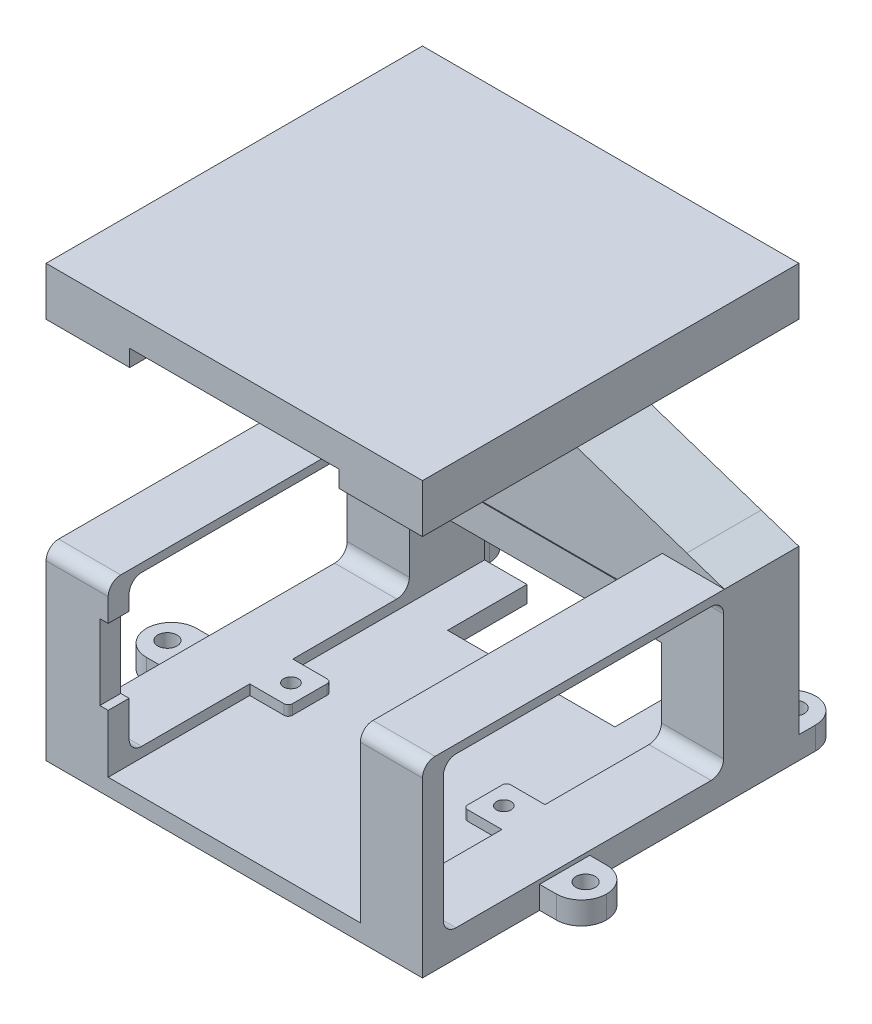
from build123d import *
from OCP.BRepFilletAPI import BRepFilletAPI_MakeChamfer

# Parameters (mm, degrees)
ESQUISSE2_W             = 90
ESQUISSE2_H             = 90
BOSS_EXTRU_1_DEPTH      = 4
ESQUISSE3_W             = 9.2
ESQUISSE3_H             = 10.3
BOSS_EXTRU_2_DEPTH      = 2.4
CONG_1_R                = 1
ESQUISSE5_W             = 14.85
ESQUISSE5_H             = 90
BOSS_EXTRU_3_DEPTH      = 2.4
ESQUISSE6_W             = 14.85
ESQUISSE6_H             = 5
BOSS_EXTRU_4_DEPTH      = 38
ESQUISSE8_W             = 14.85
ESQUISSE8_H             = 18
BOSS_EXTRU_5_DEPTH      = 38
BOSS_EXTRU_6_REACH      = 97.814
ESQUISSE9_W             = 14.85
ESQUISSE9_H             = 2
CONG_1_OF_SYM_TRIE1_R   = 1
ENL_V_MAT_EXTRU_1_REACH = 111.983
ESQUISSE10_W            = 2
ESQUISSE10_H            = 18
ENL_V_MAT_EXTRU_2_REACH = 77.38
ESQUISSE11_W            = 40
ESQUISSE11_H            = 18
BOSS_EXTRU_7_REACH      = 100.203
ESQUISSE12_W            = 5.5
ESQUISSE12_H            = 7.6
ESQUISSE13_W            = 6.9
ESQUISSE13_H            = 7.6
BOSS_EXTRU_8_DEPTH      = 2.45
CONG_2_R                = 1
CONG_2_OF_SYM_TRIE2_R   = 1
BOSS_EXTRU_9_DEPTH      = 3
BOSS_EXTRU_9_DEPTH_BACK = 3
ESQUISSE14_W            = 90
ESQUISSE14_H            = 17.8
ESQUISSE15_W            = 15
ESQUISSE15_H            = 17.8
BOSS_EXTRU_10_DEPTH     = 44
ESQUISSE16_W            = 90
ESQUISSE16_H            = 90
BOSS_EXTRU_11_DEPTH     = 11.6
ESQUISSE20_W            = 12
ESQUISSE20_H            = 5.4
BOSS_EXTRU_13_DEPTH     = 10
ESQUISSE21_W            = 12
ESQUISSE21_H            = 5.4
BOSS_EXTRU_14_DEPTH     = 10
CONG_3_R                = 6
ENL_V_MAT_EXTRU_4_REACH = 126.022
ESQUISSE23_R            = 2.3
CONG_3_OF_SYM_TRIE3_R   = 6
ENL_V_MAT_EXTRU_5_REACH = 126.022
ESQUISSE24_R            = 1.75
ENL_V_MAT_EXTRU_6_REACH = 137.909
ESQUISSE26_R            = 1.75
ESQUISSE27_W            = 50
ESQUISSE27_H            = 4
ENL_V_MAT_EXTRU_7_DEPTH = 72.2
CHANFREIN3_SIZE         = 28.5
CHANFREIN3_SIZE2        = 9.5
CHANFREIN4_SIZE         = 10
CHANFREIN4_SIZE2        = 17.5
CHANFREIN8_START        = -45
CHANFREIN8_DEPTH        = 17.8
CHANFREIN9_SIZE         = 3
CHANFREIN9_SIZE_2       = 9
CHANFREIN10_START       = 25.930676813
CHANFREIN10_OUTLINE_W   = 40
CHANFREIN10_OUTLINE_H   = 3.16227766
CHANFREIN10_DEPTH       = 2.069323187
CONG_9_R                = 3
CHANFREIN13_START       = -45
CHANFREIN13_DEPTH       = 17.8
CONG_10_R               = 3
ESQUISSE37_R            = 4
ENL_V_MAT_EXTRU_8_DEPTH = 3
BOSS_EXTRU_15_DEPTH     = 5.3
CONG_11_R               = 3


with BuildPart() as part:
    # Esquisse2 → Boss.-Extru.1 (new body)
    with BuildSketch(Plane(origin=(0, 0, 0), x_dir=(1, 0, 0), z_dir=(0, 1, 0))):
        Rectangle(ESQUISSE2_W, ESQUISSE2_H)
    extrude(amount=BOSS_EXTRU_1_DEPTH)

    # Esquisse3 → Boss.-Extru.2 (add)
    with BuildSketch(Plane(origin=(0, 4, 0), x_dir=(1, 0, 0), z_dir=(0, 1, 0))):
        with Locations((25.55, -6)):
            Rectangle(ESQUISSE3_W, ESQUISSE3_H)
    boss_extru_2 = extrude(amount=BOSS_EXTRU_2_DEPTH)

    # Congé1
    cong_1_edges = [part.edges().sort_by_distance(p)[0] for p in [
        (20.95, 5.2, 0.85),
        (20.95, 5.2, 11.15),
    ]]
    fillet(cong_1_edges, radius=CONG_1_R)

    # Esquisse5 → Boss.-Extru.3 (add)
    with BuildSketch(Plane(origin=(0, 4, 0), x_dir=(1, 0, 0), z_dir=(0, 1, 0))):
        with Locations((37.575, 0)):
            Rectangle(ESQUISSE5_W, ESQUISSE5_H)
    boss_extru_3 = extrude(amount=BOSS_EXTRU_3_DEPTH)

    # Esquisse6 → Boss.-Extru.4 (add)
    with BuildSketch(Plane(origin=(0, 6.4, 0), x_dir=(1, 0, 0), z_dir=(0, 1, 0))):
        with Locations((37.575, -42.5)):
            Rectangle(ESQUISSE6_W, ESQUISSE6_H)
    boss_extru_4 = extrude(amount=BOSS_EXTRU_4_DEPTH)

    # Esquisse8 → Boss.-Extru.5 (add)
    with BuildSketch(Plane(origin=(0, 6.4, 0), x_dir=(1, 0, 0), z_dir=(0, 1, 0))):
        with Locations((37.575, 36)):
            Rectangle(ESQUISSE8_W, ESQUISSE8_H)
    boss_extru_5 = extrude(amount=BOSS_EXTRU_5_DEPTH)

    # Esquisse9 → Boss.-Extru.6 (add, up to next)
    with BuildSketch(Plane.XY.offset(-27), mode=Mode.PRIVATE) as boss_extru_6_sk1:
        with Locations((37.575, 43.4)):
            Rectangle(ESQUISSE9_W, ESQUISSE9_H)
    boss_extru_6_tool1 = extrude(boss_extru_6_sk1.sketch, amount=BOSS_EXTRU_6_REACH, mode=Mode.PRIVATE) - part.part
    boss_extru_6 = boss_extru_6_tool1.solids().sort_by_distance((37.575, 43.4, -27))[0]
    add(boss_extru_6)

    # Symétrie1: Boss.-Extru.2, Boss.-Extru.3, Boss.-Extru.4, Boss.-Extru.5, Boss.-Extru.6 across plane
    add(boss_extru_2.mirror(Plane(origin=(0, 0, 0), x_dir=(0, 0, 1), z_dir=(1, 0, 0))))
    add(boss_extru_3.mirror(Plane(origin=(0, 0, 0), x_dir=(0, 0, 1), z_dir=(1, 0, 0))))
    add(boss_extru_4.mirror(Plane(origin=(0, 0, 0), x_dir=(0, 0, 1), z_dir=(1, 0, 0))))
    add(boss_extru_5.mirror(Plane(origin=(0, 0, 0), x_dir=(0, 0, 1), z_dir=(1, 0, 0))))
    add(boss_extru_6.mirror(Plane(origin=(0, 0, 0), x_dir=(0, 0, 1), z_dir=(1, 0, 0))))

    # Congé1 of Symétrie1
    cong_1_of_sym_trie1_edges = [part.edges().sort_by_distance(p)[0] for p in [
        (-20.95, 5.2, 0.85),
        (-20.95, 5.2, 11.15),
    ]]
    fillet(cong_1_of_sym_trie1_edges, radius=CONG_1_OF_SYM_TRIE1_R)

    # Esquisse10 → Enlèv. mat.-Extru.1 (cut, up to next)
    with BuildSketch(Plane.XY.offset(45), mode=Mode.PRIVATE) as enl_v_mat_extru_1_sk1:
        with Locations((-31.15, 26.85)):
            Rectangle(ESQUISSE10_W, ESQUISSE10_H)
    enl_v_mat_extru_1_tool1 = extrude(enl_v_mat_extru_1_sk1.sketch, amount=-ENL_V_MAT_EXTRU_1_REACH, mode=Mode.PRIVATE) & part.part
    add(enl_v_mat_extru_1_tool1.solids().sort_by_distance((-31.15, 26.85, 45))[0], mode=Mode.SUBTRACT)

    # Esquisse11 → Enlèv. mat.-Extru.2 (cut, up to next)
    with BuildSketch(Plane(origin=(0, 4, 0), x_dir=(1, 0, 0), z_dir=(0, 1, 0)), mode=Mode.PRIVATE) as enl_v_mat_extru_2_sk1:
        with Locations((0, 36)):
            Rectangle(ESQUISSE11_W, ESQUISSE11_H)
    enl_v_mat_extru_2_tool1 = extrude(enl_v_mat_extru_2_sk1.sketch, amount=-ENL_V_MAT_EXTRU_2_REACH, mode=Mode.PRIVATE) & part.part
    add(enl_v_mat_extru_2_tool1.solids().sort_by_distance((0, 4, -36))[0], mode=Mode.SUBTRACT)

    # Esquisse12 → Boss.-Extru.7 (add, up to next)
    with BuildSketch(Plane(origin=(-30.15, 0, 0), x_dir=(0, 0, -1), z_dir=(1, 0, 0)), mode=Mode.PRIVATE) as boss_extru_7_sk1:
        with Locations((29.75, 29.84)):
            Rectangle(ESQUISSE12_W, ESQUISSE12_H)
    boss_extru_7_tool1 = extrude(boss_extru_7_sk1.sketch, amount=BOSS_EXTRU_7_REACH, mode=Mode.PRIVATE) - part.part
    add(boss_extru_7_tool1.solids().sort_by_distance((-30.15, 29.84, -29.75))[0])

    # Esquisse13 → Boss.-Extru.8 (add)
    with BuildSketch(Plane.XY.offset(-27)):
        with Locations((24.4, 29.84)):
            Rectangle(ESQUISSE13_W, ESQUISSE13_H)
    boss_extru_8 = extrude(amount=BOSS_EXTRU_8_DEPTH)

    # Congé2
    cong_2_edges = [part.edges().sort_by_distance(p)[0] for p in [
        (20.95, 33.64, -25.775),
        (20.95, 26.04, -25.775),
    ]]
    fillet(cong_2_edges, radius=CONG_2_R)

    # Symétrie2: Boss.-Extru.8 across plane
    add(boss_extru_8.mirror(Plane(origin=(0, 0, 0), x_dir=(0, 0, 1), z_dir=(1, 0, 0))))

    # Congé2 of Symétrie2
    cong_2_of_sym_trie2_edges = [part.edges().sort_by_distance(p)[0] for p in [
        (-20.95, 33.64, -25.775),
        (-20.95, 26.04, -25.775),
    ]]
    fillet(cong_2_of_sym_trie2_edges, radius=CONG_2_OF_SYM_TRIE2_R)

    # Esquisse14 → Boss.-Extru.9 (add, two sides: drawn at the far end of the back side and taken through both)
    with BuildSketch(Plane(origin=(0, 44.4, 0), x_dir=(1, 0, 0), z_dir=(0, 1, 0)).offset(-BOSS_EXTRU_9_DEPTH_BACK)):
        with Locations((0, 36.1)):
            Rectangle(ESQUISSE14_W, ESQUISSE14_H)
    extrude(amount=BOSS_EXTRU_9_DEPTH + BOSS_EXTRU_9_DEPTH_BACK)

    # Esquisse15 → Boss.-Extru.10 (add)
    with BuildSketch(Plane(origin=(0, 47.4, 0), x_dir=(1, 0, 0), z_dir=(0, 1, 0))):
        with Locations((0, 36.1)):
            Rectangle(ESQUISSE15_W, ESQUISSE15_H)
    extrude(amount=BOSS_EXTRU_10_DEPTH)

    # Esquisse16 → Boss.-Extru.11 (add)
    with BuildSketch(Plane(origin=(0, 91.4, 0), x_dir=(1, 0, 0), z_dir=(0, 1, 0))):
        Rectangle(ESQUISSE16_W, ESQUISSE16_H)
    extrude(amount=BOSS_EXTRU_11_DEPTH)

    # Esquisse20 → Boss.-Extru.13 (add)
    with BuildSketch(Plane(origin=(45, 0, 0), x_dir=(0, 0, -1), z_dir=(1, 0, 0))):
        with Locations((-11, 2.7)):
            Rectangle(ESQUISSE20_W, ESQUISSE20_H)
    boss_extru_13 = extrude(amount=BOSS_EXTRU_13_DEPTH)

    # Esquisse21 → Boss.-Extru.14 (add)
    with BuildSketch(Plane(origin=(0, 0, -45), x_dir=(-1, 0, 0), z_dir=(0, 0, -1))):
        with Locations((-39, 2.7)):
            Rectangle(ESQUISSE21_W, ESQUISSE21_H)
    boss_extru_14 = extrude(amount=BOSS_EXTRU_14_DEPTH)

    # Congé3
    cong_3_edges = [part.edges().sort_by_distance(p)[0] for p in [
        (33, 2.7, -55),
        (45, 2.7, -55),
        (55, 2.7, 5),
        (55, 2.7, 17),
    ]]
    fillet(cong_3_edges, radius=CONG_3_R - 0.0001)  # a hair under: the kernel refuses the full size

    # Esquisse23 → Enlèv. mat.-Extru.4 (cut, up to next)
    with BuildSketch(Plane(origin=(0, 6.4, 0), x_dir=(1, 0, 0), z_dir=(0, 1, 0)), mode=Mode.PRIVATE) as enl_v_mat_extru_4_sk1:
        with Locations(Location((50, -11, 0), (0, 0, 90))):
            Circle(ESQUISSE23_R)
    enl_v_mat_extru_4_tool1 = extrude(enl_v_mat_extru_4_sk1.sketch, amount=-ENL_V_MAT_EXTRU_4_REACH, mode=Mode.PRIVATE) & part.part
    # Esquisse23 → Enlèv. mat.-Extru.4 (cut, up to next)
    with BuildSketch(Plane(origin=(0, 6.4, 0), x_dir=(1, 0, 0), z_dir=(0, 1, 0)), mode=Mode.PRIVATE) as enl_v_mat_extru_4_sk2:
        with Locations(Location((39, 50, 0), (0, 0, 90))):
            Circle(ESQUISSE23_R)
    enl_v_mat_extru_4_tool2 = extrude(enl_v_mat_extru_4_sk2.sketch, amount=-ENL_V_MAT_EXTRU_4_REACH, mode=Mode.PRIVATE) & part.part
    enl_v_mat_extru_4_1 = enl_v_mat_extru_4_tool1.solids().sort_by_distance((50, 6.4, 11))[0]
    add(enl_v_mat_extru_4_1, mode=Mode.SUBTRACT)
    enl_v_mat_extru_4_2 = enl_v_mat_extru_4_tool2.solids().sort_by_distance((39, 6.4, -50))[0]
    add(enl_v_mat_extru_4_2, mode=Mode.SUBTRACT)
    enl_v_mat_extru_4 = enl_v_mat_extru_4_1 + enl_v_mat_extru_4_2  # Enlèv. mat.-Extru.4 as one shape, for the pattern or mirror that repeats it

    # Symétrie3: Boss.-Extru.13, Boss.-Extru.14, Enlèv. mat.-Extru.4 across plane
    add(boss_extru_13.mirror(Plane(origin=(0, 0, 0), x_dir=(0, 0, 1), z_dir=(1, 0, 0))))
    add(boss_extru_14.mirror(Plane(origin=(0, 0, 0), x_dir=(0, 0, 1), z_dir=(1, 0, 0))))
    add(enl_v_mat_extru_4.mirror(Plane(origin=(0, 0, 0), x_dir=(0, 0, 1), z_dir=(1, 0, 0))), mode=Mode.SUBTRACT)

    # Congé3 of Symétrie3
    cong_3_of_sym_trie3_edges = [part.edges().sort_by_distance(p)[0] for p in [
        (-33, 2.7, -55),
        (-45, 2.7, -55),
        (-55, 2.7, 5),
        (-55, 2.7, 17),
    ]]
    fillet(cong_3_of_sym_trie3_edges, radius=CONG_3_OF_SYM_TRIE3_R - 0.0001)  # a hair under: the kernel refuses the full size

    # Esquisse24 → Enlèv. mat.-Extru.5 (cut, up to next)
    with BuildSketch(Plane(origin=(0, 6.4, 0), x_dir=(1, 0, 0), z_dir=(0, 1, 0)), mode=Mode.PRIVATE) as enl_v_mat_extru_5_sk1:
        with Locations(Location((25.45, -6, 0), (0, 0, 270))):
            Circle(ESQUISSE24_R)
    enl_v_mat_extru_5_tool1 = extrude(enl_v_mat_extru_5_sk1.sketch, amount=-ENL_V_MAT_EXTRU_5_REACH, mode=Mode.PRIVATE) & part.part
    enl_v_mat_extru_5 = enl_v_mat_extru_5_tool1.solids().sort_by_distance((25.45, 6.4, 6))[0]
    add(enl_v_mat_extru_5, mode=Mode.SUBTRACT)

    # Esquisse26 → Enlèv. mat.-Extru.6 (cut, up to next)
    with BuildSketch(Plane.XY.offset(-24.55), mode=Mode.PRIVATE) as enl_v_mat_extru_6_sk1:
        with Locations((25.55, 28.44)):
            Circle(ESQUISSE26_R)
    enl_v_mat_extru_6_tool1 = extrude(enl_v_mat_extru_6_sk1.sketch, amount=-ENL_V_MAT_EXTRU_6_REACH, mode=Mode.PRIVATE) & part.part
    enl_v_mat_extru_6 = enl_v_mat_extru_6_tool1.solids().sort_by_distance((25.55, 28.44, -24.55))[0]
    add(enl_v_mat_extru_6, mode=Mode.SUBTRACT)

    # Symétrie5: Enlèv. mat.-Extru.5, Enlèv. mat.-Extru.6 across plane
    add(enl_v_mat_extru_5.mirror(Plane(origin=(0, 0, 0), x_dir=(0, 0, 1), z_dir=(1, 0, 0))), mode=Mode.SUBTRACT)
    add(enl_v_mat_extru_6.mirror(Plane(origin=(0, 0, 0), x_dir=(0, 0, 1), z_dir=(1, 0, 0))), mode=Mode.SUBTRACT)

    # Esquisse27 → Enlèv. mat.-Extru.7 (cut)
    with BuildSketch(Plane.XY.offset(45)):
        with Locations((0, 93.4)):
            Rectangle(ESQUISSE27_W, ESQUISSE27_H)
    extrude(amount=-ENL_V_MAT_EXTRU_7_DEPTH, mode=Mode.SUBTRACT)

    # Chanfrein3: one chamfer whose edges measure the first distance from different faces: ONE call of the kernel's chamfer builder (chamfer() names one face for all edges)
    chanfrein3_edges_1 = [part.edges().sort_by_distance(p)[0] for p in [
        (-7.5, 47.4, -36.1),
    ]]
    chanfrein3_side_1 = [part.faces().sort_by_distance(p)[0] for p in [
        (-26.25, 47.4, -36.1),
    ]]
    chanfrein3_edges_2 = [part.edges().sort_by_distance(p)[0] for p in [
        (7.5, 47.4, -36.1),
    ]]
    chanfrein3_side_2 = [part.faces().sort_by_distance(p)[0] for p in [
        (26.25, 47.4, -36.1),
    ]]
    chanfrein3 = BRepFilletAPI_MakeChamfer(part.part.solid().wrapped)
    for e in chanfrein3_edges_1:
        chanfrein3.Add(CHANFREIN3_SIZE, CHANFREIN3_SIZE2, e.wrapped, chanfrein3_side_1[0].wrapped)  # the first distance lies on this face
    for e in chanfrein3_edges_2:
        chanfrein3.Add(CHANFREIN3_SIZE, CHANFREIN3_SIZE2, e.wrapped, chanfrein3_side_2[0].wrapped)  # the first distance lies on this face
    add(Compound.cast(chanfrein3.Shape()), mode=Mode.REPLACE)

    # Chanfrein4: one chamfer whose edges measure the first distance from different faces: ONE call of the kernel's chamfer builder (chamfer() names one face for all edges)
    chanfrein4_edges_1 = [part.edges().sort_by_distance(p)[0] for p in [
        (7.5, 91.4, -36.1),
    ]]
    chanfrein4_side_1 = [part.faces().sort_by_distance(p)[0] for p in [
        (7.5, 74.15, -36.1),
    ]]
    chanfrein4_edges_2 = [part.edges().sort_by_distance(p)[0] for p in [
        (-7.5, 91.4, -36.1),
    ]]
    chanfrein4_side_2 = [part.faces().sort_by_distance(p)[0] for p in [
        (-7.5, 74.15, -36.1),
    ]]
    chanfrein4 = BRepFilletAPI_MakeChamfer(part.part.solid().wrapped)
    for e in chanfrein4_edges_1:
        chanfrein4.Add(CHANFREIN4_SIZE, CHANFREIN4_SIZE2, e.wrapped, chanfrein4_side_1[0].wrapped)  # the first distance lies on this face
    for e in chanfrein4_edges_2:
        chanfrein4.Add(CHANFREIN4_SIZE, CHANFREIN4_SIZE2, e.wrapped, chanfrein4_side_2[0].wrapped)  # the first distance lies on this face
    add(Compound.cast(chanfrein4.Shape()), mode=Mode.REPLACE)

    # Chanfrein8: read off the stored shape, not the designer's step
    # Chanfrein8 outline → Chanfrein8 (add)
    with BuildSketch(Plane.XY.offset(CHANFREIN8_START)):
        Polygon((30.15, 31.35), (30.15, 41.4), (0, 41.4), align=None)
    extrude(amount=CHANFREIN8_DEPTH)

    # Chanfrein9
    chanfrein9_edges_1 = [part.edges().sort_by_distance(p)[0] for p in [
        (45, 47.4, -36.1),
    ]]
    chanfrein9_side_1 = [part.faces().sort_by_distance(p)[0] for p in [
        (45, 47.34, -36.1),
    ]]
    chanfrein9_edges_2 = [part.edges().sort_by_distance(p)[0] for p in [
        (-45, 47.4, -36.1),
    ]]
    chanfrein9_side_2 = [part.faces().sort_by_distance(p)[0] for p in [
        (-44.94, 47.4, -36.1),
    ]]
    chanfrein9 = BRepFilletAPI_MakeChamfer(part.part.solid().wrapped)
    for e in chanfrein9_edges_1:
        chanfrein9.Add(CHANFREIN9_SIZE - 0.0001, CHANFREIN9_SIZE_2 - 0.0001, e.wrapped, chanfrein9_side_1[0].wrapped)
    for e in chanfrein9_edges_2:
        chanfrein9.Add(CHANFREIN9_SIZE_2 - 0.0001, CHANFREIN9_SIZE - 0.0001, e.wrapped, chanfrein9_side_2[0].wrapped)
    add(Compound.cast(chanfrein9.Shape()), mode=Mode.REPLACE)  # a hair under: the kernel refuses the full size

    # Chanfrein10: read off the stored shape, not the designer's step
    # Chanfrein10 outline → Chanfrein10 (cut)
    with BuildSketch(Plane(origin=(0, 0, 0), x_dir=(1, 0, 0), z_dir=(0, 0.31622776601683705, -0.9486832980505141)).offset(CHANFREIN10_START)):
        with Locations((0, 6.008327554)):
            Rectangle(CHANFREIN10_OUTLINE_W, CHANFREIN10_OUTLINE_H)
    extrude(amount=CHANFREIN10_DEPTH, mode=Mode.SUBTRACT)

    # Congé9
    cong_9_edges = [part.edges().sort_by_distance(p)[0] for p in [
        (-37.575, 44.4, 45),
        (-37.575, 6.4, 40),
        (-37.575, 6.4, -27),
        (-37.575, 42.4, 40),
        (-37.575, 42.4, -27),
        (37.575, 6.4, 40),
        (37.575, 44.4, 45),
        (37.575, 6.4, -27),
        (37.575, 42.4, 40),
        (37.575, 42.4, -27),
    ]]
    fillet(cong_9_edges, radius=CONG_9_R)

    # Chanfrein13: read off the stored shape, not the designer's step
    # Chanfrein13 outline → Chanfrein13 (add)
    with BuildSketch(Plane.XY.offset(CHANFREIN13_START)):
        Polygon((-30.15, 30.9), (0.675, 41.175), (0, 41.4), (-30.15, 41.4), align=None)
    extrude(amount=CHANFREIN13_DEPTH)

    # Congé10
    cong_10_edges = [part.edges().sort_by_distance(p)[0] for p in [
        (0, 95.4, -27.2),
    ]]
    fillet(cong_10_edges, radius=CONG_10_R)

    # Esquisse37 → Enlèv. mat.-Extru.8 (cut)
    with BuildSketch(Plane.XZ):
        with Locations(Location((-25.45, 6, 0), (0, 0, 270))):
            Circle(ESQUISSE37_R)
        with Locations(Location((25.45, 6, 0), (0, 0, 270))):
            Circle(ESQUISSE37_R)
    extrude(amount=-ENL_V_MAT_EXTRU_8_DEPTH, mode=Mode.SUBTRACT)

    # Esquisse38 → Boss.-Extru.15 (add)
    with BuildSketch(Plane.XY.offset(-27.2)):
        Polygon((0.675, 41.175), (-21.95, 33.64), (23.28, 33.64), align=None)
    extrude(amount=-BOSS_EXTRU_15_DEPTH)

    # Congé11
    cong_11_edges = [part.edges().sort_by_distance(p)[0] for p in [
        (7.5, 56.9, -36.1),
        (-7.5, 56.9, -36.1),
        (-25, 91.4, -36.1),
        (-7.5, 81.4, -36.1),
        (25, 91.4, -36.1),
        (7.5, 81.4, -36.1),
        (30.15, 31.35, -38.75),
        (-30.15, 30.9, -38.75),
        (0.675, 41.175, -38.75),
    ]]
    fillet(cong_11_edges, radius=CONG_11_R)


solid = part.part
